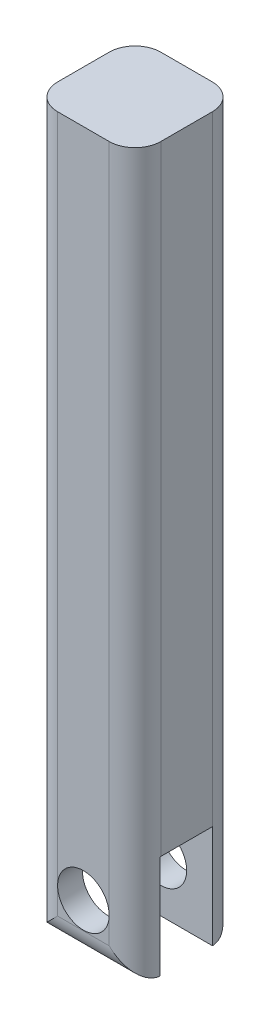
from build123d import *

# Parameters (mm, degrees)
SKETCH1_W           = 20
SKETCH1_H           = 20
BOSS_EXTRUDE1_DEPTH = 140
SKETCH2_R           = 5
CUT_EXTRUDE1_DEPTH  = 142.774468788
SKETCH3_W           = 10.2
SKETCH3_H           = 20
CUT_EXTRUDE2_DEPTH  = 142.774468788
FILLET1_R           = 5


with BuildPart() as part:
    # Sketch1 → Boss-Extrude1 (new body)
    with BuildSketch(Plane(origin=(0, 0, 0), x_dir=(1, 0, 0), z_dir=(0, 1, 0))):
        Rectangle(SKETCH1_W, SKETCH1_H)
    extrude(amount=BOSS_EXTRUDE1_DEPTH)

    # Sketch2 → Cut-Extrude1 (cut, through all)
    with BuildSketch(Plane.XY.offset(10)):
        with Locations((0, 10.125979961)):
            Circle(SKETCH2_R)
    extrude(amount=-CUT_EXTRUDE1_DEPTH, mode=Mode.SUBTRACT)

    # Sketch3 → Cut-Extrude2 (cut, through all)
    with BuildSketch(Plane(origin=(10, 0, 0), x_dir=(0, 0, -1), z_dir=(1, 0, 0))):
        with Locations((-0.09, 10)):
            Rectangle(SKETCH3_W, SKETCH3_H)
    extrude(amount=-CUT_EXTRUDE2_DEPTH, mode=Mode.SUBTRACT)

    # Fillet1
    # the kernel refuses this fillet: 5 mm, written as the material it takes off along each edge
    with BuildSketch(Plane(origin=(22.5, 0, -10), x_dir=(0, 0, 1), z_dir=(-1, 0, 0))) as fillet1_piece_1:
        with BuildLine():
            CenterArc((FILLET1_R, FILLET1_R), FILLET1_R, 180, 90)
            Line((0, FILLET1_R), (0, 0))
            Line((0, 0), (FILLET1_R, 0))
        make_face()
    extrude(amount=45, mode=Mode.SUBTRACT)
    with BuildSketch(Plane(origin=(-22.49097174, 0, 10), x_dir=(0, 1, 0), z_dir=(1, 0, 0))) as fillet1_piece_2:
        with BuildLine():
            CenterArc((4.996388696, -5), FILLET1_R, 90, 87.822236049)
            Line((0, -4.81), (0, 0))
            Line((0, 0), (4.996388696, 0))
        make_face()
    extrude(amount=44.981943479, mode=Mode.SUBTRACT)
    with BuildSketch(Plane(origin=(-10, -12.5, -10), x_dir=(0, 0, 1), z_dir=(0, 1, 0)), Plane(origin=(-10, -12.5, 10), x_dir=(1, 0, 0), z_dir=(0, 1, 0))) as fillet1_piece_3:
        with BuildLine():
            CenterArc((FILLET1_R, FILLET1_R), FILLET1_R, 180, 90)
            Line((0, FILLET1_R), (0, 0))
            Line((0, 0), (FILLET1_R, 0))
        make_face()
    extrude(amount=165, mode=Mode.SUBTRACT)
    with BuildSketch(Plane(origin=(10, -12.5, -10), x_dir=(0, 0, 1), z_dir=(0, 1, 0)), Plane(origin=(10, -12.5, 10), x_dir=(-1, 0, 0), z_dir=(0, 1, 0))) as fillet1_piece_4:
        with BuildLine():
            CenterArc((FILLET1_R, -FILLET1_R), FILLET1_R, 90, 90)
            Line((0, -FILLET1_R), (0, 0))
            Line((0, 0), (FILLET1_R, 0))
        make_face()
    extrude(amount=165, mode=Mode.SUBTRACT)


solid = part.part
